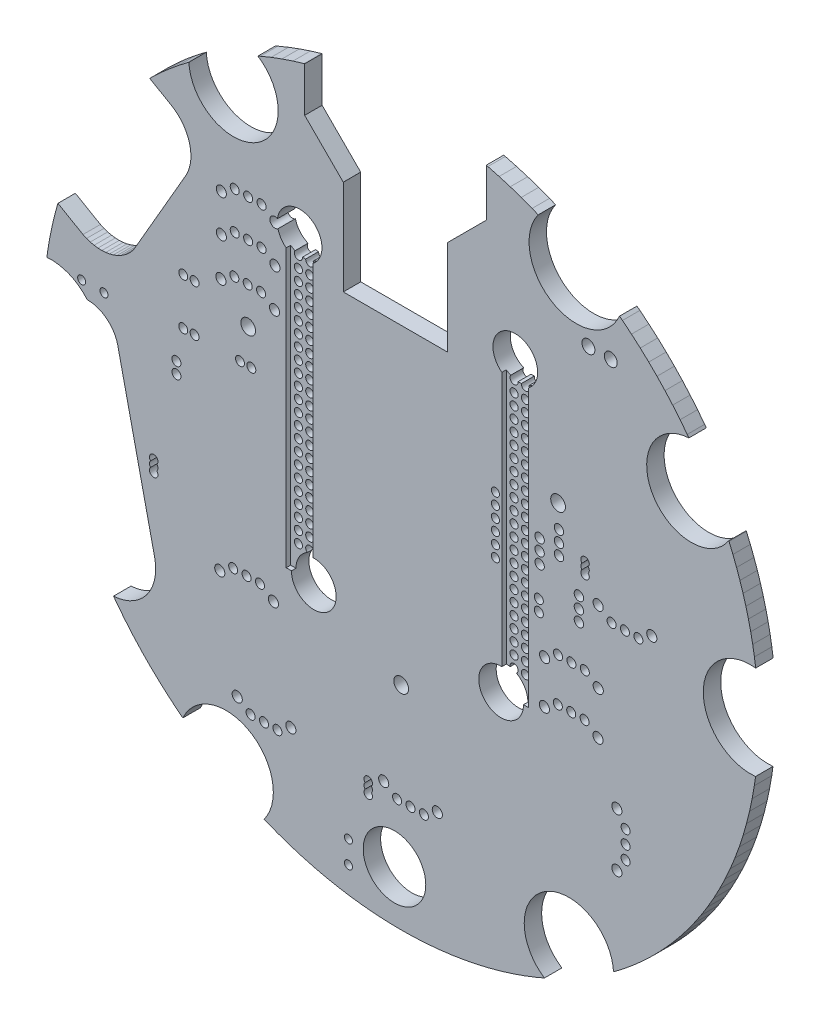
from build123d import *
from build123d.topology import SkipClean

# Parameters (mm, degrees)
SZKIC1_R                    = 3
DODANIE_WYCI_GNI_CIE1_DEPTH = 3.9
CUT_EXTRUDE1_DEPTH          = 1
SKETCH2_R                   = 5
CUT_EXTRUDE2_DEPTH          = 113.747958045
SKETCH3_R                   = 7
CUT_EXTRUDE3_DEPTH          = 113.747958045
CUT_EXTRUDE4_START          = -20
CUT_EXTRUDE4_DEPTH          = 20
SKETCH6_R                   = 1.01
SKETCH6_R_2                 = 1
SKETCH6_R_3                 = 1.135
SKETCH6_R_4                 = 0.95
SKETCH6_R_5                 = 0.91
SKETCH6_R_6                 = 0.9
SKETCH6_R_7                 = 1.05
SKETCH6_R_8                 = 1.45
CUT_EXTRUDE5_DEPTH          = 20
DODANIE_WYCI_GNI_CIE2_START = -3.9
SZKIC2_R                    = 3
SZKIC2_R_2                  = 1.65
DODANIE_WYCI_GNI_CIE2_DEPTH = 3.9


with BuildPart() as part:
    # Szkic1 → Dodanie-wyciągnięcie1 (new body)
    with BuildSketch(Plane.XY):
        with BuildLine():
            Line((-71.57962062, -7.983371532), (-71.312597874, -9.139973792))
            Line((-71.312597874, -9.139973792), (-68.53523504, -8.49876888))
            Line((-68.53523504, -8.49876888), (-68.19394794, -8.41997808))
            Line((-68.19394794, -8.41997808), (-67.49664428, -8.35283572))
            Line((-67.49664428, -8.35283572), (-66.79654408, -8.37728322))
            Line((-66.79654408, -8.37728322), (-66.10562344, -8.49290402))
            Line((-66.10562344, -8.49290402), (-65.43570352, -8.69771946))
            Line((-65.43570352, -8.69771946), (-64.79824988, -8.98822434))
            Line((-64.79824988, -8.98822434), (-64.20416928, -9.35944788))
            Line((-64.20416928, -9.35944788), (-63.66362426, -9.80504008))
            Line((-63.66362426, -9.80504008), (-63.1858655, -10.31737332))
            Line((-63.1858655, -10.31737332), (-62.77906926, -10.8876846))
            Line((-62.77906926, -10.8876846), (-62.45019006, -11.50621524))
            Line((-62.45019006, -11.50621524), (-62.20486162, -12.1623836))
            Line((-62.20486162, -12.1623836), (-62.1260632, -12.50366054))
            Line((-62.1260632, -12.50366054), (-61.33063934, -15.94903846))
            Line((-61.33063934, -15.94903846), (-61.25184854, -16.29032556))
            Line((-61.25184854, -16.29032556), (-61.18470618, -16.98762922))
            Line((-61.18470618, -16.98762922), (-61.20915368, -17.68772942))
            Line((-61.20915368, -17.68772942), (-61.32477448, -18.37865006))
            Line((-61.32477448, -18.37865006), (-61.52958738, -19.04856998))
            Line((-61.52958738, -19.04856998), (-61.82009226, -19.68602362))
            Line((-61.82009226, -19.68602362), (-62.1913158, -20.28010422))
            Line((-62.1913158, -20.28010422), (-62.63690546, -20.82064924))
            Line((-62.63690546, -20.82064924), (-63.14924124, -21.298408))
            Line((-63.14924124, -21.298408), (-63.71955252, -21.70520678))
            Line((-63.71955252, -21.70520678), (-64.33808062, -22.03408598))
            Line((-64.33808062, -22.03408598), (-64.99424644, -22.27941442))
            Line((-64.99424644, -22.27941442), (-65.33552338, -22.35820776))
            Line((-65.33552338, -22.35820776), (-76.05586516, -24.83318884))
            Line((-76.05586516, -24.83318884), (-75.54626496, -26.37281238))
            Line((-75.54626496, -26.37281238), (-74.65067366, -28.8104199))
            Line((-74.65067366, -28.8104199), (-73.67645158, -31.21768458))
            Line((-73.67645158, -31.21768458), (-73.304524984, -32.057268652))
            ThreePointArc((-73.304524984, -32.057268652), (-56.277053256, -32.525271386), (-64.370269597, -47.513722582))
            Line((-64.370269597, -47.513722582), (-63.5862457, -48.5784144))
            Line((-63.5862457, -48.5784144), (-61.8316772, -50.79288038))
            Line((-61.8316772, -50.79288038), (-60.00002478, -52.9440267))
            Line((-60.00002478, -52.9440267), (-58.09357698, -55.02916858))
            Line((-58.09357698, -55.02916858), (-56.11470362, -57.0457076))
            Line((-56.11470362, -57.0457076), (-54.06587612, -58.99113424))
            Line((-54.06587612, -58.99113424), (-51.94964972, -60.86301772))
            Line((-51.94964972, -60.86301772), (-49.7686584, -62.65902632))
            Line((-49.7686584, -62.65902632), (-48.854025047, -63.359525568))
            ThreePointArc((-48.854025047, -63.359525568), (-33.882392112, -58.494836786), (-30.664292357, -73.904535798))
            Line((-30.664292357, -73.904535798), (-30.33088422, -74.04802818))
            Line((-30.33088422, -74.04802818), (-27.69790498, -75.07262354))
            Line((-27.69790498, -75.07262354), (-25.03039952, -76.0036326))
            Line((-25.03039952, -76.0036326), (-22.33168762, -76.8398895))
            Line((-22.33168762, -76.8398895), (-19.60513732, -77.58035538))
            Line((-19.60513732, -77.58035538), (-16.8541446, -78.22410568))
            Line((-16.8541446, -78.22410568), (-14.082141, -78.77033776))
            Line((-14.082141, -78.77033776), (-11.29258346, -79.2183709))
            Line((-11.29258346, -79.2183709), (-8.4889467, -79.56764884))
            Line((-8.4889467, -79.56764884), (-5.6747283, -79.81773216))
            Line((-5.6747283, -79.81773216), (-2.85343346, -79.96831098))
            Line((-2.85343346, -79.96831098), (-0.02858516, -80.0191948))
            Line((-0.02858516, -80.0191948), (2.79630124, -79.97032774))
            Line((2.79630124, -79.97032774), (5.61770276, -79.82176568))
            Line((5.61770276, -79.82176568), (8.43209896, -79.5736915))
            Line((8.43209896, -79.5736915), (11.23598464, -79.22641762))
            Line((11.23598464, -79.22641762), (14.02586222, -78.78037838))
            Line((14.02586222, -78.78037838), (16.79825444, -78.23612496))
            Line((16.79825444, -78.23612496), (19.54970436, -77.59434062))
            Line((19.54970436, -77.59434062), (22.27678552, -76.85582292))
            Line((22.27678552, -76.85582292), (24.97609178, -76.02149388))
            Line((24.97609178, -76.02149388), (27.64426526, -75.09239236))
            Line((27.64426526, -75.09239236), (30.27797348, -74.0696766))
            Line((30.27797348, -74.0696766), (32.058084413, -73.305058296))
            ThreePointArc((32.058084413, -73.305058296), (32.526945476, -56.276085802), (47.513994724, -64.375103628))
            Line((47.513994724, -64.375103628), (47.99231702, -64.02949094))
            Line((47.99231702, -64.02949094), (50.20371976, -62.31071104))
            Line((50.20371976, -62.31071104), (52.35361386, -60.51559398))
            Line((52.35361386, -60.51559398), (54.43937042, -58.6463394))
            Line((54.43937042, -58.6463394), (56.45843166, -56.7052333))
            Line((56.45843166, -56.7052333), (58.40832616, -54.6946582))
            Line((58.40832616, -54.6946582), (60.28666124, -52.61707536))
            Line((60.28666124, -52.61707536), (62.0911382, -50.47502986))
            Line((62.0911382, -50.47502986), (63.8195447, -48.27114806))
            Line((63.8195447, -48.27114806), (65.46976746, -46.0081249))
            Line((65.46976746, -46.0081249), (67.03977956, -43.68873914))
            Line((67.03977956, -43.68873914), (68.52766076, -41.31582796))
            Line((68.52766076, -41.31582796), (69.93158734, -38.89229966))
            Line((69.93158734, -38.89229966), (71.24983972, -36.42112604))
            Line((71.24983972, -36.42112604), (72.48080246, -33.9053297))
            Line((72.48080246, -33.9053297), (73.6229668, -31.34799674))
            Line((73.6229668, -31.34799674), (74.6749332, -28.75225644))
            Line((74.6749332, -28.75225644), (75.63541642, -26.12129396))
            Line((75.63541642, -26.12129396), (76.50323536, -23.45832748))
            Line((76.50323536, -23.45832748), (77.2773283, -20.76662344))
            Line((77.2773283, -20.76662344), (77.95674782, -18.04947622))
            Line((77.95674782, -18.04947622), (78.5406608, -15.31021576))
            Line((78.5406608, -15.31021576), (79.02835096, -12.55219994))
            Line((79.02835096, -12.55219994), (79.299411436, -10.628909904))
            ThreePointArc((79.299411436, -10.628909904), (67.599207973, -0.09719794), (79.333602634, 10.39640487))
            Line((79.333602634, 10.39640487), (79.04494478, 12.42009454))
            Line((79.04494478, 12.42009454), (78.6613108, 14.6546951))
            Line((78.6613108, 14.6546951), (78.21451972, 16.87752784))
            Line((78.21451972, 16.87752784), (77.70492714, 19.08680968))
            Line((77.70492714, 19.08680968), (77.13294454, 21.28076516))
            Line((77.13294454, 21.28076516), (76.49902912, 23.45763406))
            Line((76.49902912, 23.45763406), (75.80368888, 25.61566886))
            Line((75.80368888, 25.61566886), (75.0474877, 27.75313728))
            Line((75.0474877, 27.75313728), (74.23102756, 29.86831974))
            Line((74.23102756, 29.86831974), (73.35496378, 31.95952206))
            Line((73.35496378, 31.95952206), (73.308184112, 32.062869193))
            ThreePointArc((73.308184112, 32.062869193), (56.277888121, 32.52382733), (64.373618175, 47.513911347))
            Line((64.373618175, 47.513911347), (64.00781966, 48.0183825))
            Line((64.00781966, 48.0183825), (62.41427192, 50.07219348))
            Line((62.41427192, 50.07219348), (60.75485182, 52.07315976))
            Line((60.75485182, 52.07315976), (59.03130942, 54.01916806))
            Line((59.03130942, 54.01916806), (57.2454659, 55.90816352))
            Line((57.2454659, 55.90816352), (55.3992034, 57.73815224))
            Line((55.3992034, 57.73815224), (53.49447264, 59.50720382))
            Line((53.49447264, 59.50720382), (51.53328276, 61.21345136))
            Line((51.53328276, 61.21345136), (49.5177064, 62.855094))
            Line((49.5177064, 62.855094), (48.854412275, 63.360399614))
            ThreePointArc((48.854412275, 63.360399614), (33.885789996, 58.492867797), (30.660209654, 73.898975364))
            Line((30.660209654, 73.898975364), (29.29812276, 74.46063594))
            Line((29.29812276, 74.46063594), (26.86397218, 75.3730268))
            Line((26.86397218, 75.3730268), (24.40147012, 76.2058674))
            Line((24.40147012, 76.2058674), (21.913215, 76.95828144))
            Line((21.913215, 76.95828144), (19.40183064, 77.6294739))
            Line((19.40183064, 77.6294739), (19.04364746, 77.7128367))
            Line((19.04364746, 77.7128367), (19.04365, 67.0536505))
            Line((19.04365, 67.0536505), (10.41764998, 58.42765048))
            Line((10.41764998, 58.42765048), (10.41764998, 37.15114998))
            Line((10.41764998, 37.15114998), (-12.95035002, 37.15114998))
            Line((-12.95035002, 37.15114998), (-12.95035256, 58.4176505))
            Line((-12.95035256, 58.4176505), (-12.96035, 58.4176505))
            Line((-12.96035, 58.4176505), (-21.59635, 67.0536505))
            Line((-21.59635, 67.0536505), (-21.59635254, 77.04573364))
            Line((-21.59635254, 77.04573364), (-21.72109448, 77.01272888))
            Line((-21.72109448, 77.01272888), (-24.21122158, 76.26652768))
            Line((-24.21122158, 76.26652768), (-26.67579374, 75.43983134))
            Line((-26.67579374, 75.43983134), (-29.11221254, 74.5335187))
            Line((-29.11221254, 74.5335187), (-31.5179075, 73.54853972))
            Line((-31.5179075, 73.54853972), (-32.059481022, 73.305971081))
            ThreePointArc((-32.059481022, 73.305971081), (-32.526681058, 56.27623858), (-47.514053862, 64.376159651))
            Line((-47.514053862, 64.376159651), (-47.84248242, 64.13937642))
            Line((-47.84248242, 64.13937642), (-49.89862766, 62.55309562))
            Line((-49.89862766, 62.55309562), (-51.90221522, 60.90092722))
            Line((-51.90221522, 60.90092722), (-53.85113436, 59.18461366))
            Line((-53.85113436, 59.18461366), (-55.74333022, 57.40595834))
            Line((-55.74333022, 57.40595834), (-56.27645844, 56.87119182))
            Line((-56.27645844, 56.87119182), (-51.51362062, 54.1213675))
            Line((-51.51362062, 54.1213675), (-51.13540192, 53.90299608))
            Line((-51.13540192, 53.90299608), (-50.4254008, 53.3942163))
            Line((-50.4254008, 53.3942163), (-49.76868634, 52.81829416))
            Line((-49.76868634, 52.81829416), (-49.17158314, 52.18077702))
            Line((-49.17158314, 52.18077702), (-48.6398443, 51.48780152))
            Line((-48.6398443, 51.48780152), (-48.17859046, 50.74604532))
            Line((-48.17859046, 50.74604532), (-47.79226154, 49.96264836))
            Line((-47.79226154, 49.96264836), (-47.48457864, 49.14515698))
            Line((-47.48457864, 49.14515698), (-47.25850594, 48.30144518))
            Line((-47.25850594, 48.30144518), (-47.11622022, 47.43963588))
            Line((-47.11622022, 47.43963588), (-47.05909308, 46.5680298))
            Line((-47.05909308, 46.5680298), (-47.08767062, 45.69502164))
            Line((-47.08767062, 45.69502164), (-47.2016836, 44.8290188))
            Line((-47.2016836, 44.8290188), (-47.40002966, 43.97836264))
            Line((-47.40002966, 43.97836264), (-47.68079872, 43.15124212))
            Line((-47.68079872, 43.15124212), (-48.04128822, 42.35562268))
            Line((-48.04128822, 42.35562268), (-48.2596571, 41.9773989))
            Line((-48.2596571, 41.9773989), (-59.43565202, 22.62000048))
            Line((-59.43565202, 22.62000048), (-59.65402598, 22.24177416))
            Line((-59.65402598, 22.24177416), (-60.16280576, 21.53177304))
            Line((-60.16280576, 21.53177304), (-60.7387279, 20.87506112))
            Line((-60.7387279, 20.87506112), (-61.37624758, 20.27795792))
            Line((-61.37624758, 20.27795792), (-62.06922054, 19.74622162))
            Line((-62.06922054, 19.74622162), (-62.81097928, 19.28496778))
            Line((-62.81097928, 19.28496778), (-63.5943737, 18.89863886))
            Line((-63.5943737, 18.89863886), (-64.41186508, 18.59095596))
            Line((-64.41186508, 18.59095596), (-65.25557688, 18.3648858))
            Line((-65.25557688, 18.3648858), (-66.11738618, 18.22260008))
            Line((-66.11738618, 18.22260008), (-66.98898972, 18.16547294))
            Line((-66.98898972, 18.16547294), (-67.86199788, 18.19405048))
            Line((-67.86199788, 18.19405048), (-68.72800072, 18.30806346))
            Line((-68.72800072, 18.30806346), (-69.57865688, 18.50640698))
            Line((-69.57865688, 18.50640698), (-70.4057774, 18.78717858))
            Line((-70.4057774, 18.78717858), (-71.2013943, 19.14766554))
            Line((-71.2013943, 19.14766554), (-71.57962062, 19.36603442))
            Line((-71.57962062, 19.36603442), (-76.81740034, 22.39006698))
            Line((-76.81740034, 22.39006698), (-76.88341494, 22.17438796))
            Line((-76.88341494, 22.17438796), (-77.56249156, 19.66782198))
            Line((-77.56249156, 19.66782198), (-78.15986908, 17.14053976))
            Line((-78.15986908, 17.14053976), (-78.67492266, 14.59520068))
            Line((-78.67492266, 14.59520068), (-79.1071062, 12.03449206))
            Line((-79.1071062, 12.03449206), (-79.289748918, 10.687222926))
            ThreePointArc((-79.289748918, 10.687222926), (-68.55606183, 4.192492209), (-71.57962062, -7.983371532))
        make_face()
        with Locations((0, -32.5400162)):
            Circle(SZKIC1_R, mode=Mode.SUBTRACT)
        with Locations((35.10868772, 20.27001026)):
            Circle(SZKIC1_R, mode=Mode.SUBTRACT)
        with Locations((-34.24266202, 19.77001126)):
            Circle(SZKIC1_R, mode=Mode.SUBTRACT)
    extrude(amount=DODANIE_WYCI_GNI_CIE1_DEPTH)

    # Sketch1 → Cut-Extrude1 (cut)
    with BuildSketch(Plane.XY.offset(3.9)):
        with BuildLine():
            Line((22.5310005, 39.310999375), (22.5310005, -17.732064063))
            ThreePointArc((22.5310005, -17.732064063), (18.773048188, -26.216471447), (27.355840497, -22.689000625))
            Line((27.355840497, -22.689000625), (28.5310005, -22.689000625))
            Line((28.5310005, -22.689000625), (28.5310005, 39.310999375))
            ThreePointArc((28.5310005, 39.310999375), (25.5310005, 48.310999375), (22.5310005, 39.310999375))
        make_face()
        with BuildLine():
            Line((-19.7289995, 39.310999375), (-19.7289995, -17.732064063))
            ThreePointArc((-19.7289995, -17.732064063), (-15.968393489, -26.213743016), (-24.553894601, -22.696612641))
            Line((-24.553894601, -22.696612641), (-25.7289995, -22.689000625))
            Line((-25.7289995, -22.689000625), (-25.7289995, 39.310999375))
            ThreePointArc((-25.7289995, 39.310999375), (-22.7289995, 48.310999375), (-19.7289995, 39.310999375))
        make_face()
    extrude(amount=-CUT_EXTRUDE1_DEPTH, mode=Mode.SUBTRACT)

    # Sketch2 → Cut-Extrude2 (cut, through all)
    with SkipClean():  # the faces are left unmerged after this step: merging them gives an invalid solid
        with BuildSketch(Plane.XY.offset(3.9)):
            with Locations((-22.7289995, 43.310999375)):
                Circle(SKETCH2_R)
            with Locations((25.5310005, 43.310999375)):
                Circle(SKETCH2_R)
            with Locations((22.3560005, -22.729000625)):
                Circle(SKETCH2_R)
            with Locations((-19.5539995, -22.729000625)):
                Circle(SKETCH2_R)
        extrude(amount=-CUT_EXTRUDE2_DEPTH, mode=Mode.SUBTRACT)

    # Sketch3 → Cut-Extrude3 (cut, through all)
    with SkipClean():  # the faces are left unmerged after this step: merging them gives an invalid solid
        with BuildSketch(Plane.XY.offset(3.9)):
            with Locations((-1.5, -68.5400162)):
                Circle(SKETCH3_R)
            with Locations((-70.24266202, 0)):
                Circle(SKETCH3_R)
        extrude(amount=-CUT_EXTRUDE3_DEPTH, mode=Mode.SUBTRACT)

    # Sketch5 → Cut-Extrude4 (cut)
    with SkipClean():  # the faces are left unmerged after this step: merging them gives an invalid solid
        with BuildSketch(Plane.XY.offset(3.9).offset(CUT_EXTRUDE4_START)):
            with BuildLine():
                Line((-63.410970787, 1.525776819), (-55.175208412, -35.34998701))
                ThreePointArc((-55.175208412, -35.34998701), (-63.147762723, -27.690632932), (-73.304524984, -32.057268652))
                Line((-73.304524984, -32.057268652), (-73.67645158, -31.21768458))
                Line((-73.67645158, -31.21768458), (-74.65067366, -28.8104199))
                Line((-74.65067366, -28.8104199), (-75.54626496, -26.37281238))
                Line((-75.54626496, -26.37281238), (-76.05586516, -24.83318884))
                Line((-76.05586516, -24.83318884), (-65.33552338, -22.35820776))
                Line((-65.33552338, -22.35820776), (-64.99424644, -22.27941442))
                Line((-64.99424644, -22.27941442), (-64.33808062, -22.03408598))
                Line((-64.33808062, -22.03408598), (-63.71955252, -21.70520678))
                Line((-63.71955252, -21.70520678), (-63.14924124, -21.298408))
                Line((-63.14924124, -21.298408), (-62.63690546, -20.82064924))
                Line((-62.63690546, -20.82064924), (-62.1913158, -20.28010422))
                Line((-62.1913158, -20.28010422), (-61.82009226, -19.68602362))
                Line((-61.82009226, -19.68602362), (-61.52958738, -19.04856998))
                Line((-61.52958738, -19.04856998), (-61.32477448, -18.37865006))
                Line((-61.32477448, -18.37865006), (-61.20915368, -17.68772942))
                Line((-61.20915368, -17.68772942), (-61.18470618, -16.98762922))
                Line((-61.18470618, -16.98762922), (-61.25184854, -16.29032556))
                Line((-61.25184854, -16.29032556), (-61.33063934, -15.94903846))
                Line((-61.33063934, -15.94903846), (-62.1260632, -12.50366054))
                Line((-62.1260632, -12.50366054), (-62.20486162, -12.1623836))
                Line((-62.20486162, -12.1623836), (-62.45019006, -11.50621524))
                Line((-62.45019006, -11.50621524), (-62.77906926, -10.8876846))
                Line((-62.77906926, -10.8876846), (-63.1858655, -10.31737332))
                Line((-63.1858655, -10.31737332), (-63.66362426, -9.80504008))
                Line((-63.66362426, -9.80504008), (-64.20416928, -9.35944788))
                Line((-64.20416928, -9.35944788), (-64.79824988, -8.98822434))
                Line((-64.79824988, -8.98822434), (-65.43570352, -8.69771946))
                Line((-65.43570352, -8.69771946), (-66.10562344, -8.49290402))
                Line((-66.10562344, -8.49290402), (-66.79654408, -8.37728322))
                Line((-66.79654408, -8.37728322), (-67.49664428, -8.35283572))
                Line((-67.49664428, -8.35283572), (-68.19394794, -8.41997808))
                Line((-68.19394794, -8.41997808), (-68.53523504, -8.49876888))
                Line((-68.53523504, -8.49876888), (-71.312597874, -9.139973792))
                Line((-71.312597874, -9.139973792), (-71.57962062, -7.983371532))
                ThreePointArc((-71.57962062, -7.983371532), (-71.042517531, -7.506231055), (-70.539051899, -6.993722402))
                ThreePointArc((-70.539051899, -6.993722402), (-64.873955687, -4.49188071), (-63.410970787, 1.525776819))
            make_face()
        extrude(amount=CUT_EXTRUDE4_DEPTH, mode=Mode.SUBTRACT)

    # Sketch6 → Cut-Extrude5 (cut)
    with SkipClean():  # the faces are left unmerged after this step: merging them gives an invalid solid
        with BuildSketch(Plane(origin=(0, 0, 0), x_dir=(-1, 0, 0), z_dir=(0, 0, -1))):
            with Locations((31.24835002, 36.57414998)):
                Circle(SKETCH6_R)
            with Locations((48.77435002, 22.60414998)):
                Circle(SKETCH6_R_2)
            with Locations((46.23435002, 22.60414998)):
                Circle(SKETCH6_R_2)
            with Locations((40.24835002, 42.99614998)):
                Circle(SKETCH6_R_3)
            with Locations((37.24835002, 44.95614998)):
                Circle(SKETCH6_R)
            with Locations((34.24835002, 44.95614998)):
                Circle(SKETCH6_R)
            with Locations((31.24835002, 44.95614998)):
                Circle(SKETCH6_R)
            with Locations((28.24835002, 42.99614998)):
                Circle(SKETCH6_R_3)
            with Locations((37.24835002, 36.57414998)):
                Circle(SKETCH6_R)
            with Locations((34.24835002, 36.57414998)):
                Circle(SKETCH6_R)
            with Locations((40.24835002, 34.61414998)):
                Circle(SKETCH6_R_3)
            with Locations((55.37835002, -17.78185002)):
                Circle(SKETCH6_R_4)
            with Locations((55.37835002, -19.05185002)):
                Circle(SKETCH6_R_4)
            with Locations((23.99935002, -10.02885002)):
                Circle(SKETCH6_R_5)
            with Locations((23.99935002, -12.56885002)):
                Circle(SKETCH6_R_5)
            with Locations((21.45935002, -10.02885002)):
                Circle(SKETCH6_R_5)
            with Locations((21.45935002, -12.56885002)):
                Circle(SKETCH6_R_5)
            with Locations((23.99935002, -15.10885002)):
                Circle(SKETCH6_R_5)
            with Locations((23.99935002, -17.64885002)):
                Circle(SKETCH6_R_5)
            with Locations((21.45935002, -15.10885002)):
                Circle(SKETCH6_R_5)
            with Locations((21.45935002, -17.64885002)):
                Circle(SKETCH6_R_5)
            with Locations((37.59835002, -28.70385002)):
                Circle(SKETCH6_R)
            with Locations((34.59835002, -28.70385002)):
                Circle(SKETCH6_R)
            with Locations((40.59835002, -30.66385002)):
                Circle(SKETCH6_R_3)
            with Locations((31.59835002, -28.70385002)):
                Circle(SKETCH6_R)
            with Locations((28.59835002, -30.66385002)):
                Circle(SKETCH6_R_3)
            with Locations((36.69235002, -53.15985002)):
                Circle(SKETCH6_R_3)
            with Locations((33.69235002, -55.11985002)):
                Circle(SKETCH6_R)
            with Locations((30.69235002, -55.11985002)):
                Circle(SKETCH6_R)
            with Locations((27.69235002, -55.11985002)):
                Circle(SKETCH6_R)
            with Locations((24.69235002, -53.15985002)):
                Circle(SKETCH6_R_3)
            with Locations((11.80035002, -68.29985002)):
                Circle(SKETCH6_R_6)
            with Locations((11.80035002, -73.29985002)):
                Circle(SKETCH6_R_6)
            with Locations((-24.26064998, -10.02885002)):
                Circle(SKETCH6_R_5)
            with Locations((-26.80064998, -10.02885002)):
                Circle(SKETCH6_R_5)
            with Locations((-24.26064998, -12.56885002)):
                Circle(SKETCH6_R_5)
            with Locations((-26.80064998, -12.56885002)):
                Circle(SKETCH6_R_5)
            with Locations((-24.26064998, -15.10885002)):
                Circle(SKETCH6_R_5)
            with Locations((-26.80064998, -15.10885002)):
                Circle(SKETCH6_R_5)
            with Locations((-24.26064998, -17.64885002)):
                Circle(SKETCH6_R_5)
            with Locations((-26.80064998, -17.64885002)):
                Circle(SKETCH6_R_5)
            with Locations((-32.09364998, -11.10585002)):
                Circle(SKETCH6_R_3)
            with Locations((-35.04564998, -18.79785002)):
                Circle(SKETCH6_R)
            with Locations((-32.04564998, -20.75785002)):
                Circle(SKETCH6_R_3)
            with Locations((-38.04564998, -18.79785002)):
                Circle(SKETCH6_R)
            with Locations((-44.09364998, -11.10585002)):
                Circle(SKETCH6_R_3)
            with Locations((-41.04564998, -18.79785002)):
                Circle(SKETCH6_R)
            with Locations((-44.04564998, -20.75785002)):
                Circle(SKETCH6_R_3)
            with Locations((-48.26464998, -32.35585002)):
                Circle(SKETCH6_R_3)
            with Locations((-50.22464998, -35.35585002)):
                Circle(SKETCH6_R)
            with Locations((-50.22464998, -38.35585002)):
                Circle(SKETCH6_R)
            with Locations((-50.22464998, -41.35585002)):
                Circle(SKETCH6_R)
            with Locations((3.91635002, -53.15385002)):
                Circle(SKETCH6_R_3)
            with Locations((0.91635002, -55.11385002)):
                Circle(SKETCH6_R)
            with Locations((-2.08364998, -55.11385002)):
                Circle(SKETCH6_R)
            with Locations((-5.08364998, -55.11385002)):
                Circle(SKETCH6_R)
            with Locations((-8.08364998, -53.15385002)):
                Circle(SKETCH6_R_3)
            with Locations((-48.26464998, -44.35585002)):
                Circle(SKETCH6_R_3)
            with Locations((-24.26064998, 5.21114998)):
                Circle(SKETCH6_R_5)
            with Locations((-26.80064998, 5.21114998)):
                Circle(SKETCH6_R_5)
            with Locations((-24.26064998, 2.67114998)):
                Circle(SKETCH6_R_5)
            with Locations((-26.80064998, 2.67114998)):
                Circle(SKETCH6_R_5)
            with Locations((-24.26064998, 0.13114998)):
                Circle(SKETCH6_R_5)
            with Locations((-26.80064998, 0.13114998)):
                Circle(SKETCH6_R_5)
            with Locations((-30.79964998, -0.45985002)):
                Circle(SKETCH6_R)
            with Locations((-39.76764998, 4.63314998)):
                Circle(SKETCH6_R_7)
            with Locations((-39.76764998, 2.09314998)):
                Circle(SKETCH6_R_7)
            with Locations((-39.76764998, -0.44685002)):
                Circle(SKETCH6_R_7)
            with Locations((-24.26064998, -2.40885002)):
                Circle(SKETCH6_R_5)
            with Locations((-26.80064998, -2.40885002)):
                Circle(SKETCH6_R_5)
            with Locations((-24.26064998, -4.94885002)):
                Circle(SKETCH6_R_5)
            with Locations((-26.80064998, -4.94885002)):
                Circle(SKETCH6_R_5)
            with Locations((-30.79964998, -2.99985002)):
                Circle(SKETCH6_R)
            with Locations((-24.26064998, -7.48885002)):
                Circle(SKETCH6_R_5)
            with Locations((-26.80064998, -7.48885002)):
                Circle(SKETCH6_R_5)
            with Locations((-35.09364998, -9.14585002)):
                Circle(SKETCH6_R)
            with Locations((-38.09364998, -9.14585002)):
                Circle(SKETCH6_R)
            with Locations((-44.07964998, 5.00614998)):
                Circle(SKETCH6_R_3)
            with Locations((-47.07964998, 3.04614998)):
                Circle(SKETCH6_R)
            with Locations((-50.07964998, 3.04614998)):
                Circle(SKETCH6_R)
            with Locations((-56.07964998, 5.00614998)):
                Circle(SKETCH6_R_3)
            with Locations((-53.07964998, 3.04614998)):
                Circle(SKETCH6_R)
            with Locations((-41.09364998, -9.14585002)):
                Circle(SKETCH6_R)
            with Locations((55.37835002, -16.51185002)):
                Circle(SKETCH6_R_4)
            with Locations((21.45935002, 10.29114998)):
                Circle(SKETCH6_R_5)
            with Locations((21.45935002, 7.75114998)):
                Circle(SKETCH6_R_5)
            with Locations((23.99935002, 5.21114998)):
                Circle(SKETCH6_R_5)
            with Locations((23.99935002, 2.67114998)):
                Circle(SKETCH6_R_5)
            with Locations((21.45935002, 5.21114998)):
                Circle(SKETCH6_R_5)
            with Locations((21.45935002, 2.67114998)):
                Circle(SKETCH6_R_5)
            with Locations((23.99935002, 0.13114998)):
                Circle(SKETCH6_R_5)
            with Locations((21.45935002, 0.13114998)):
                Circle(SKETCH6_R_5)
            with Locations((23.99935002, -2.40885002)):
                Circle(SKETCH6_R_5)
            with Locations((23.99935002, -4.94885002)):
                Circle(SKETCH6_R_5)
            with Locations((21.45935002, -2.40885002)):
                Circle(SKETCH6_R_5)
            with Locations((21.45935002, -4.94885002)):
                Circle(SKETCH6_R_5)
            with Locations((23.99935002, -7.48885002)):
                Circle(SKETCH6_R_5)
            with Locations((21.45935002, -7.48885002)):
                Circle(SKETCH6_R_5)
            with Locations((-41.89964998, 54.00014998)):
                Circle(SKETCH6_R_8)
            with Locations((-46.89964998, 54.00014998)):
                Circle(SKETCH6_R_8)
            with Locations((-24.26064998, 38.23114998)):
                Circle(SKETCH6_R_5)
            with Locations((-26.80064998, 38.23114998)):
                Circle(SKETCH6_R_5)
            with Locations((-24.26064998, 35.69114998)):
                Circle(SKETCH6_R_5)
            with Locations((-26.80064998, 35.69114998)):
                Circle(SKETCH6_R_5)
            with Locations((-24.26064998, 33.15114998)):
                Circle(SKETCH6_R_5)
            with Locations((-26.80064998, 33.15114998)):
                Circle(SKETCH6_R_5)
            with Locations((-24.26064998, 30.61114998)):
                Circle(SKETCH6_R_5)
            with Locations((-26.80064998, 30.61114998)):
                Circle(SKETCH6_R_5)
            with Locations((-24.26064998, 28.07114998)):
                Circle(SKETCH6_R_5)
            with Locations((-26.80064998, 28.07114998)):
                Circle(SKETCH6_R_5)
            with Locations((-24.26064998, 25.53114998)):
                Circle(SKETCH6_R_5)
            with Locations((-26.80064998, 25.53114998)):
                Circle(SKETCH6_R_5)
            with Locations((-24.26064998, 22.99114998)):
                Circle(SKETCH6_R_5)
            with Locations((-26.80064998, 22.99114998)):
                Circle(SKETCH6_R_5)
            with Locations((-21.08564998, 15.37114998)):
                Circle(SKETCH6_R_5)
            with Locations((-21.08564998, 12.83114998)):
                Circle(SKETCH6_R_5)
            with Locations((-21.08564998, 10.29114998)):
                Circle(SKETCH6_R_5)
            with Locations((-21.08564998, 7.75114998)):
                Circle(SKETCH6_R_5)
            with Locations((-21.08564998, 5.21114998)):
                Circle(SKETCH6_R_5)
            with Locations((-21.08564998, 2.67114998)):
                Circle(SKETCH6_R_5)
            with Locations((-24.26064998, 20.45114998)):
                Circle(SKETCH6_R_5)
            with Locations((-26.80064998, 20.45114998)):
                Circle(SKETCH6_R_5)
            with Locations((-24.26064998, 17.91114998)):
                Circle(SKETCH6_R_5)
            with Locations((-26.80064998, 17.91114998)):
                Circle(SKETCH6_R_5)
            with Locations((-24.26064998, 15.37114998)):
                Circle(SKETCH6_R_5)
            with Locations((-26.80064998, 15.37114998)):
                Circle(SKETCH6_R_5)
            with Locations((-35.30564998, 15.24014998)):
                Circle(SKETCH6_R_7)
            with Locations((-24.26064998, 12.83114998)):
                Circle(SKETCH6_R_5)
            with Locations((-26.80064998, 12.83114998)):
                Circle(SKETCH6_R_5)
            with Locations((-30.98164998, 11.42814998)):
                Circle(SKETCH6_R_7)
            with Locations((-24.26064998, 10.29114998)):
                Circle(SKETCH6_R_5)
            with Locations((-26.80064998, 10.29114998)):
                Circle(SKETCH6_R_5)
            with Locations((-24.26064998, 7.75114998)):
                Circle(SKETCH6_R_5)
            with Locations((-26.80064998, 7.75114998)):
                Circle(SKETCH6_R_5)
            with Locations((-30.98164998, 8.88814998)):
                Circle(SKETCH6_R_7)
            with Locations((-30.98164998, 6.34814998)):
                Circle(SKETCH6_R_7)
            with Locations((-35.30564998, 12.70014998)):
                Circle(SKETCH6_R_7)
            with Locations((-35.30564998, 10.16014998)):
                Circle(SKETCH6_R_7)
            with Locations((28.24835002, 34.61414998)):
                Circle(SKETCH6_R_3)
            with Locations((37.34435002, 27.93814998)):
                Circle(SKETCH6_R)
            with Locations((34.34435002, 27.93814998)):
                Circle(SKETCH6_R)
            with Locations((40.34435002, 25.97814998)):
                Circle(SKETCH6_R_3)
            with Locations((31.34435002, 27.93814998)):
                Circle(SKETCH6_R)
            with Locations((28.34435002, 25.97814998)):
                Circle(SKETCH6_R_3)
            with Locations((23.99935002, 38.23114998)):
                Circle(SKETCH6_R_5)
            with Locations((23.99935002, 35.69114998)):
                Circle(SKETCH6_R_5)
            with Locations((21.45935002, 38.23114998)):
                Circle(SKETCH6_R_5)
            with Locations((21.45935002, 35.69114998)):
                Circle(SKETCH6_R_5)
            with Locations((23.99935002, 33.15114998)):
                Circle(SKETCH6_R_5)
            with Locations((23.99935002, 30.61114998)):
                Circle(SKETCH6_R_5)
            with Locations((21.45935002, 33.15114998)):
                Circle(SKETCH6_R_5)
            with Locations((21.45935002, 30.61114998)):
                Circle(SKETCH6_R_5)
            with Locations((23.99935002, 28.07114998)):
                Circle(SKETCH6_R_5)
            with Locations((21.45935002, 28.07114998)):
                Circle(SKETCH6_R_5)
            with Locations((23.99935002, 25.53114998)):
                Circle(SKETCH6_R_5)
            with Locations((23.99935002, 22.99114998)):
                Circle(SKETCH6_R_5)
            with Locations((21.45935002, 25.53114998)):
                Circle(SKETCH6_R_5)
            with Locations((21.45935002, 22.99114998)):
                Circle(SKETCH6_R_5)
            with Locations((71.50035002, 10.20014998)):
                Circle(SKETCH6_R_6)
            with Locations((66.50035002, 10.20014998)):
                Circle(SKETCH6_R_6)
            with Locations((48.77435002, 12.19014998)):
                Circle(SKETCH6_R_2)
            with Locations((46.23435002, 12.19014998)):
                Circle(SKETCH6_R_2)
            with Locations((50.29835002, 5.07814998)):
                Circle(SKETCH6_R)
            with Locations((50.29835002, 2.53814998)):
                Circle(SKETCH6_R)
            with Locations((36.07435002, 12.19014998)):
                Circle(SKETCH6_R_2)
            with Locations((33.53435002, 12.19014998)):
                Circle(SKETCH6_R_2)
            with Locations((23.99935002, 20.45114998)):
                Circle(SKETCH6_R_5)
            with Locations((21.45935002, 20.45114998)):
                Circle(SKETCH6_R_5)
            with Locations((23.99935002, 17.91114998)):
                Circle(SKETCH6_R_5)
            with Locations((23.99935002, 15.37114998)):
                Circle(SKETCH6_R_5)
            with Locations((21.45935002, 17.91114998)):
                Circle(SKETCH6_R_5)
            with Locations((21.45935002, 15.37114998)):
                Circle(SKETCH6_R_5)
            with Locations((23.99935002, 12.83114998)):
                Circle(SKETCH6_R_5)
            with Locations((21.45935002, 12.83114998)):
                Circle(SKETCH6_R_5)
            with Locations((23.99935002, 10.29114998)):
                Circle(SKETCH6_R_5)
            with Locations((23.99935002, 7.75114998)):
                Circle(SKETCH6_R_5)
            with BuildLine():
                ThreePointArc((8.078943963, -55.50085002), (7.37235002, -53.91585002), (6.665756077, -55.50085002))
                ThreePointArc((6.665756077, -55.50085002), (6.42235002, -56.13585002), (6.665756077, -56.77085002))
                ThreePointArc((6.665756077, -56.77085002), (7.37235002, -58.35585002), (8.078943963, -56.77085002))
                ThreePointArc((8.078943963, -56.77085002), (8.32235002, -56.13585002), (8.078943963, -55.50085002))
            make_face()
            with BuildLine():
                ThreePointArc((-41.848243923, 10.03114998), (-41.14164998, 8.44614998), (-40.435056037, 10.03114998))
                ThreePointArc((-40.435056037, 10.03114998), (-40.19164998, 10.66614998), (-40.435056037, 11.30114998))
                ThreePointArc((-40.435056037, 11.30114998), (-41.14164998, 12.88614998), (-41.848243923, 11.30114998))
                ThreePointArc((-41.848243923, 11.30114998), (-42.09164998, 10.66614998), (-41.848243923, 10.03114998))
            make_face()
        extrude(amount=-CUT_EXTRUDE5_DEPTH, mode=Mode.SUBTRACT)

    # Szkic2 → Dodanie-wyciągnięcie2 (add)
    # profile 1 of 3: a face of its own
    with SkipClean():  # the faces are left unmerged after this step: merging them gives an invalid solid
        with BuildSketch(Plane.XY.offset(3.9).offset(DODANIE_WYCI_GNI_CIE2_START)):
            with Locations((0, -32.5400162)):
                Circle(SZKIC2_R)
            with Locations((0, -32.5400162)):
                Circle(SZKIC2_R_2, mode=Mode.SUBTRACT)
        # profile 2 of 3: a face of its own
        with BuildSketch(Plane.XY.offset(3.9).offset(DODANIE_WYCI_GNI_CIE2_START)):
            with Locations((35.10868772, 20.27001026)):
                Circle(SZKIC2_R)
            with Locations((35.10868772, 20.27001026)):
                Circle(SZKIC2_R_2, mode=Mode.SUBTRACT)
        # profile 3 of 3: a face of its own
        with BuildSketch(Plane.XY.offset(3.9).offset(DODANIE_WYCI_GNI_CIE2_START)):
            with Locations((-34.24266202, 19.77001126)):
                Circle(SZKIC2_R)
            with Locations((-34.24266202, 19.77001126)):
                Circle(SZKIC2_R_2, mode=Mode.SUBTRACT)
        extrude(amount=DODANIE_WYCI_GNI_CIE2_DEPTH)


solid = part.part
